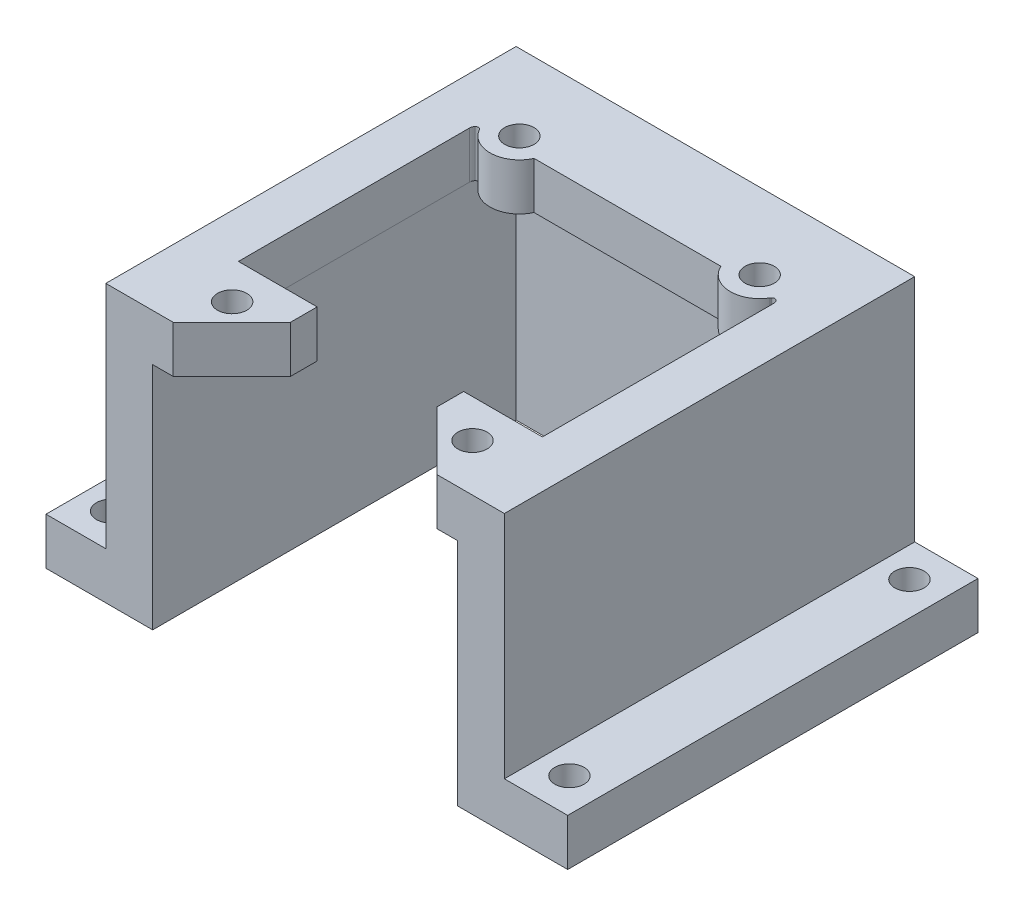
from build123d import *

# Parameters (mm, degrees)
SKETCH1_W               = 44.5
SKETCH1_H               = 35
BOSS_EXTRUDE1_DEPTH     = 4
BOSS_EXTRUDE2_DEPTH     = 19.6
SKETCH4_W               = 26
SKETCH4_H               = 31
CUT_EXTRUDE1_DEPTH      = 4
BOSS_EXTRUDE3_DEPTH     = 4
CHAMFER1_SIZE           = 5
CUT_EXTRUDE2_DEPTH      = 62.336856783
CUT_EXTRUDE2_DEPTH_BACK = 62.336856783
SKETCH6_R               = 1.25
SKETCH7_R               = 2.5
SKETCH7_R_2             = 1.25
BOSS_EXTRUDE4_DEPTH     = 4
FILLET1_R               = 0.5
FILLET3_R               = 0.25
CUT_EXTRUDE3_DEPTH      = 60.911685095
CUT_EXTRUDE3_DEPTH_BACK = 60.911685095
SKETCH8_R               = 1.25


with BuildPart() as part:
    # Sketch1 → Boss-Extrude1 (new body)
    with BuildSketch(Plane(origin=(0, 0, 0), x_dir=(1, 0, 0), z_dir=(0, 1, 0))):
        with Locations((22.25, 17.5)):
            Rectangle(SKETCH1_W, SKETCH1_H)
    extrude(amount=BOSS_EXTRUDE1_DEPTH)

    # Sketch3 → Boss-Extrude2 (add)
    with BuildSketch(Plane(origin=(0, 0, 0), x_dir=(1, 0, 0), z_dir=(0, 1, 0))):
        Polygon((9.1, 31), (9.1, 0), (5.1, 0), (5.1, 35), (39.1, 35), (39.1, 0), (35.1, 0), (35.1, 31), align=None)
    extrude(amount=BOSS_EXTRUDE2_DEPTH)

    # Sketch4 → Cut-Extrude1 (cut)
    with BuildSketch(Plane(origin=(0, 4, 0), x_dir=(1, 0, 0), z_dir=(0, 1, 0))):
        with Locations((22.1, 15.5)):
            Rectangle(SKETCH4_W, SKETCH4_H)
    extrude(amount=-CUT_EXTRUDE1_DEPTH, mode=Mode.SUBTRACT)

    # Sketch5 → Boss-Extrude3 (add)
    with BuildSketch(Plane(origin=(0, 19.6, 0), x_dir=(1, 0, 0), z_dir=(0, 1, 0))):
        Polygon((15.85, 0), (5.1, 0), (5.1, 35), (39.1, 35), (39.1, 0), (28.35, 0), (28.35, 7.277215151), (35.065893154, 7.277215151), (35.065893154, 27.5), (9.134106846, 27.5), (9.134106846, 7.277215151), (15.85, 7.277215151), align=None)
    extrude(amount=BOSS_EXTRUDE3_DEPTH)

    # Chamfer1
    chamfer1_edges = [part.edges().sort_by_distance(p)[0] for p in [
        (15.85, 21.6, 0),
        (28.35, 21.6, 0),
    ]]
    chamfer(chamfer1_edges, length=CHAMFER1_SIZE)

    # Sketch6 → Cut-Extrude2 (cut, two sides: drawn at the far end of the back side and taken through both)
    with BuildSketch(Plane(origin=(0, 23.6, 0), x_dir=(1, 0, 0), z_dir=(0, 1, 0)).offset(-CUT_EXTRUDE2_DEPTH_BACK)):
        with Locations(Location((11.85, 4.027215151, 0), (0, 0, 270))):
            Circle(SKETCH6_R)
        with Locations(Location((32.35, 4.027215151, 0), (0, 0, 270))):
            Circle(SKETCH6_R)
        with BuildLine():
            ThreePointArc((11.137729662, 27.5), (11.85, 27.277215151), (12.562270338, 27.5))
            Line((12.562270338, 27.5), (11.137729662, 27.5))
        make_face()
        with BuildLine():
            Line((11.137729662, 27.5), (12.562270338, 27.5))
            ThreePointArc((12.562270338, 27.5), (12.957438017, 27.947490182), (13.1, 28.527215151))
            ThreePointArc((13.1, 28.527215151), (11.270275032, 29.634653168), (11.137729662, 27.5))
        make_face()
        with BuildLine():
            ThreePointArc((33.062270338, 27.5), (33.457438017, 27.947490182), (33.6, 28.527215151))
            ThreePointArc((33.6, 28.527215151), (31.770275032, 29.634653168), (31.637729662, 27.5))
            Line((31.637729662, 27.5), (33.062270338, 27.5))
        make_face()
        with BuildLine():
            Line((33.062270338, 27.5), (31.637729662, 27.5))
            ThreePointArc((31.637729662, 27.5), (32.35, 27.277215151), (33.062270338, 27.5))
        make_face()
    extrude(amount=CUT_EXTRUDE2_DEPTH + CUT_EXTRUDE2_DEPTH_BACK, mode=Mode.SUBTRACT)

    # Sketch7 → Boss-Extrude4 (add)
    # profile 1 of 2: a face of its own
    with BuildSketch(Plane(origin=(0, 23.6, 0), x_dir=(1, 0, 0), z_dir=(0, 1, 0))):
        with Locations((11.85, 28.527215151)):
            Circle(SKETCH7_R)
        with Locations(Location((11.85, 28.527215151, 0), (0, 0, 270))):
            Circle(SKETCH7_R_2, mode=Mode.SUBTRACT)
    # profile 2 of 2: a face of its own
    with BuildSketch(Plane(origin=(0, 23.6, 0), x_dir=(1, 0, 0), z_dir=(0, 1, 0))):
        with Locations((32.35, 28.527215151)):
            Circle(SKETCH7_R)
        with Locations(Location((32.35, 28.527215151, 0), (0, 0, 270))):
            Circle(SKETCH7_R_2, mode=Mode.SUBTRACT)
    extrude(amount=-BOSS_EXTRUDE4_DEPTH)

    # Fillet1
    # the kernel refuses this fillet: 0.5 mm, written as the material it adds along each edge
    with BuildSketch(Plane(origin=(35.065893154, 19.6, -27.5), x_dir=(0, 0, 1), z_dir=(0, 1, 0)), Plane(origin=(9.134106846, 19.6, -27.5), x_dir=(1, 0, 0), z_dir=(0, 1, 0))) as fillet1_piece_1:
        with BuildLine():
            CenterArc((FILLET1_R, -FILLET1_R), FILLET1_R, 90, 90)
            Line((0, -FILLET1_R), (0, 0))
            Line((0, 0), (FILLET1_R, 0))
        make_face()
    extrude(amount=4)
    with BuildSketch(Plane(origin=(34.629216759, 19.6, -27.5), x_dir=(1, 0, 0), z_dir=(0, 1, 0))) as fillet1_piece_2:
        with BuildLine():
            CenterArc((0.30295556, -0.5), FILLET1_R, 90, 59.397982961)
            ThreePointArc((-0.127406493, -0.245464142), (-0.060306377, -0.124495193), (0, 0))
            Line((0, 0), (0.30295556, 0))
        make_face()
    extrude(amount=4)
    with BuildSketch(Plane(origin=(9.570783241, 19.6, -27.5), x_dir=(0.46068413755870835, 0, 0.8875641528372973), z_dir=(0, 1, 0))) as fillet1_piece_3:
        with BuildLine():
            CenterArc((0.304215256, -0.499234564), FILLET1_R, 93.170754575, 59.397982961)
            Line((-0.139566821, -0.268892495), (0, 0))
            ThreePointArc((0, 0), (0.138279662, -0.003827182), (0.276559323, 0))
        make_face()
    extrude(amount=4)

    # Fillet3
    fillet3_edges = [part.edges().sort_by_distance(p)[0] for p in [
        (34.749032737, 21.6, -27.465252505),
        (9.450967263, 21.6, -27.465252505),
    ]]
    fillet(fillet3_edges, radius=FILLET3_R)

    # Sketch8 → Cut-Extrude3 (cut, two sides: drawn at the far end of the back side and taken through both)
    with BuildSketch(Plane(origin=(0, 4, 0), x_dir=(1, 0, 0), z_dir=(0, 1, 0)).offset(-CUT_EXTRUDE3_DEPTH_BACK)):
        with Locations(Location((2.55, 32, 0), (0, 0, 270))):
            Circle(SKETCH8_R)
        with Locations(Location((41.65, 32, 0), (0, 0, 90))):
            Circle(SKETCH8_R)
        with Locations(Location((2.55, 3, 0), (0, 0, 270))):
            Circle(SKETCH8_R)
        with Locations(Location((41.65, 3, 0), (0, 0, 90))):
            Circle(SKETCH8_R)
    extrude(amount=CUT_EXTRUDE3_DEPTH + CUT_EXTRUDE3_DEPTH_BACK, mode=Mode.SUBTRACT)


solid = part.part
